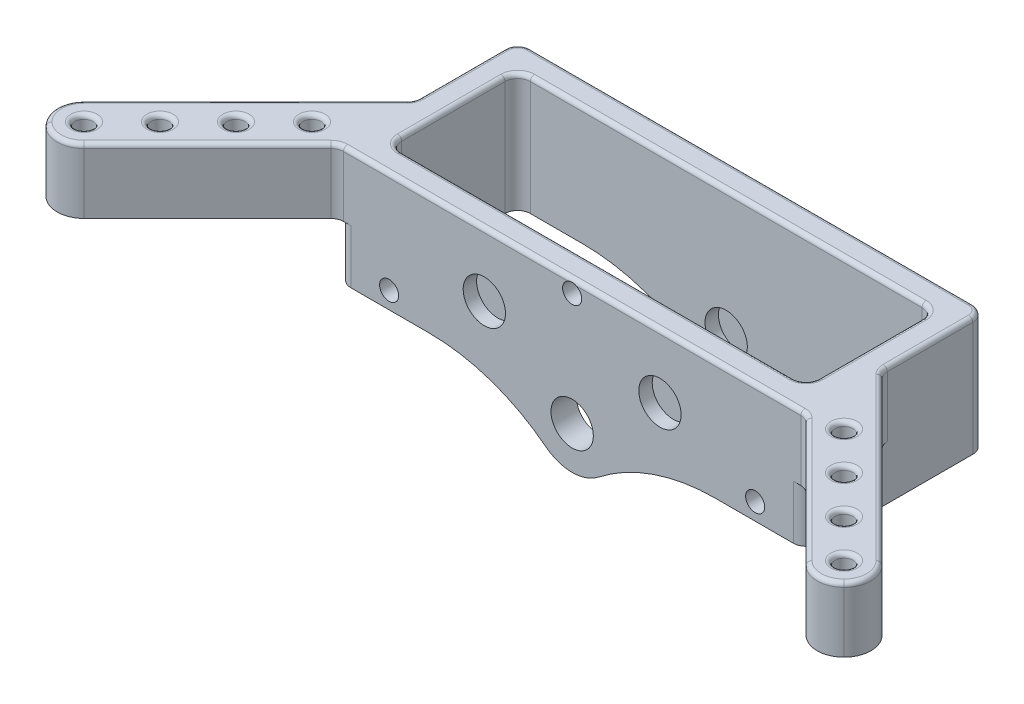
from build123d import *

# Parameters (mm, degrees)
SKETCH2_R           = 2.1
SKETCH2_W           = 98.55
SKETCH2_H           = 30.4
BOSS_EXTRUDE1_DEPTH = 28
CUT_EXTRUDE1_START  = -42.4
SKETCH3_R           = 2.25
CUT_EXTRUDE1_DEPTH  = 6
BOSS_EXTRUDE2_DEPTH = 6
BOSS_EXTRUDE3_START = -42.4
BOSS_EXTRUDE3_DEPTH = 6
CUT_EXTRUDE3_START  = -6
CUT_EXTRUDE3_DEPTH  = 3.175
CUT_EXTRUDE4_START  = -42.4
CUT_EXTRUDE4_DEPTH  = 6
FILLET2_R           = 6.35
CUT_EXTRUDE5_START  = -42.4
SKETCH4_7_R         = 5
CUT_EXTRUDE5_DEPTH  = 3.175
SKETCH2_4_R         = 2.1
CUT_EXTRUDE6_DEPTH  = 12.7
FILLET1_R           = 3
FILLET3_R           = 3
FILLET4_R           = 1


# Some blends are built 0.0001 mm under size
with BuildPart() as part:
    # Sketch2 → Boss-Extrude1 (new body)
    with BuildSketch(Plane(origin=(0, 0, 0), x_dir=(1, 0, 0), z_dir=(0, 1, 0))):
        Polygon((-89.802561211, -56.227561211), (-55.275, -21.7), (55.275, -21.7), (89.802561211, -56.227561211), (98.782817332, -47.24730509), (55.275, -3.739487758), (55.275, 20.7), (-55.275, 20.7), (-55.275, -3.739487758), (-98.782817332, -47.24730509), align=None)
        with Locations(Location((-89.802561211, -47.24730509, 0), (0, 0, 270))):
            Circle(SKETCH2_R, mode=Mode.SUBTRACT)
        with Locations(Location((-80.82230509, -38.267048969, 0), (0, 0, 270))):
            Circle(SKETCH2_R, mode=Mode.SUBTRACT)
        with Locations(Location((-71.842048969, -29.286792847, 0), (0, 0, 270))):
            Circle(SKETCH2_R, mode=Mode.SUBTRACT)
        with Locations(Location((-62.861792847, -20.306536726, 0), (0, 0, 270))):
            Circle(SKETCH2_R, mode=Mode.SUBTRACT)
        with Locations((0, -0.5)):
            Rectangle(SKETCH2_W, SKETCH2_H, mode=Mode.SUBTRACT)
        with Locations(Location((62.861792847, -20.306536726, 0), (0, 0, 270))):
            Circle(SKETCH2_R, mode=Mode.SUBTRACT)
        with Locations(Location((89.802561211, -47.24730509, 0), (0, 0, 270))):
            Circle(SKETCH2_R, mode=Mode.SUBTRACT)
        with Locations(Location((80.82230509, -38.267048969, 0), (0, 0, 270))):
            Circle(SKETCH2_R, mode=Mode.SUBTRACT)
        with Locations(Location((71.842048969, -29.286792847, 0), (0, 0, 270))):
            Circle(SKETCH2_R, mode=Mode.SUBTRACT)
    extrude(amount=BOSS_EXTRUDE1_DEPTH)

    # Sketch3 → Cut-Extrude1 (cut)
    with BuildSketch(Plane(origin=(0, 0, -20.7), x_dir=(-1, 0, 0), z_dir=(0, 0, -1)).offset(CUT_EXTRUDE1_START)):
        with Locations((-43.25, 4)):
            Circle(SKETCH3_R)
        with Locations((0, 25)):
            Circle(SKETCH3_R)
        with Locations((43.25, 4)):
            Circle(SKETCH3_R)
    extrude(amount=CUT_EXTRUDE1_DEPTH, mode=Mode.SUBTRACT)

    # Sketch4 → Boss-Extrude2 (add)
    with BuildSketch(Plane(origin=(0, 0, -20.7), x_dir=(-1, 0, 0), z_dir=(0, 0, -1))):
        with BuildLine():
            ThreePointArc((6.154225479, -9.531120391), (19.204123936, -2.44944429), (33.84824251, 0))
            Line((33.84824251, 0), (-33.848242566, 0))
            ThreePointArc((-33.848242566, 0), (-19.204124104, -2.449444233), (-6.154225714, -9.531120208))
            ThreePointArc((-6.154225714, -9.531120208), (-1.49e-07, -11.649146733), (6.154225479, -9.531120391))
        make_face()
    extrude(amount=-BOSS_EXTRUDE2_DEPTH)

    # Sketch4<3> → Boss-Extrude3 (add)
    with BuildSketch(Plane(origin=(0, 0, -20.7), x_dir=(-1, 0, 0), z_dir=(0, 0, -1)).offset(BOSS_EXTRUDE3_START)):
        with BuildLine():
            ThreePointArc((6.154225479, -9.531120391), (19.204123936, -2.44944429), (33.84824251, 0))
            Line((33.84824251, 0), (-33.848242566, 0))
            ThreePointArc((-33.848242566, 0), (-19.204124104, -2.449444233), (-6.154225714, -9.531120208))
            ThreePointArc((-6.154225714, -9.531120208), (-1.49e-07, -11.649146733), (6.154225479, -9.531120391))
        make_face()
    extrude(amount=BOSS_EXTRUDE3_DEPTH)

    # Sketch4<5> → Cut-Extrude3 (cut)
    with BuildSketch(Plane(origin=(0, 0, -20.7), x_dir=(-1, 0, 0), z_dir=(0, 0, -1)).offset(CUT_EXTRUDE3_START)):
        with BuildLine():
            ThreePointArc((5, -1.649146733), (4.929554458, -0.812789844), (4.720202861, 0))
            Line((4.720202861, 0), (-4.720202861, 0))
            ThreePointArc((-4.720202861, 0), (-0.836356889, -6.578701191), (5, -1.649146733))
        make_face()
        with BuildLine():
            Line((-4.720202861, 0), (4.720202861, 0))
            ThreePointArc((4.720202861, 0), (0, 3.350853267), (-4.720202861, 0))
        make_face()
    extrude(amount=CUT_EXTRUDE3_DEPTH, mode=Mode.SUBTRACT)

    # Sketch4<6> → Cut-Extrude4 (cut)
    with BuildSketch(Plane(origin=(0, 0, -20.7), x_dir=(-1, 0, 0), z_dir=(0, 0, -1)).offset(CUT_EXTRUDE4_START)):
        with BuildLine():
            ThreePointArc((5, -1.649146733), (4.929554458, -0.812789844), (4.720202861, 0))
            Line((4.720202861, 0), (-4.720202861, 0))
            ThreePointArc((-4.720202861, 0), (-0.836356889, -6.578701191), (5, -1.649146733))
        make_face()
        with BuildLine():
            Line((-4.720202861, 0), (4.720202861, 0))
            ThreePointArc((4.720202861, 0), (0, 3.350853267), (-4.720202861, 0))
        make_face()
    extrude(amount=CUT_EXTRUDE4_DEPTH, mode=Mode.SUBTRACT)

    # Fillet2
    fillet2_edges = [part.edges().sort_by_distance(p)[0] for p in [
        (98.782817332, 14, 47.24730509),
        (89.802561211, 14, 56.227561211),
        (-89.802561211, 14, 56.227561211),
        (-98.782817332, 14, 47.24730509),
    ]]
    fillet(fillet2_edges, radius=FILLET2_R - 0.0001)  # a hair under: the kernel refuses the full size

    # Sketch4<7> → Cut-Extrude5 (cut)
    with BuildSketch(Plane(origin=(0, 0, -20.7), x_dir=(-1, 0, 0), z_dir=(0, 0, -1)).offset(CUT_EXTRUDE5_START)):
        with Locations((-20.75, 13)):
            Circle(SKETCH4_7_R)
        with Locations((20.75, 13)):
            Circle(SKETCH4_7_R)
    extrude(amount=CUT_EXTRUDE5_DEPTH, mode=Mode.SUBTRACT)

    # Sketch2<4> → Cut-Extrude6 (cut)
    # profile 1 of 2: a face of its own
    with BuildSketch(Plane(origin=(0, 0, 0), x_dir=(1, 0, 0), z_dir=(0, 1, 0))):
        Polygon((-89.802561211, -56.227561211), (-55.275, -21.7), (-55.275, -3.739487758), (-98.782817332, -47.24730509), align=None)
        with Locations(Location((-89.802561211, -47.24730509, 0), (0, 0, 270))):
            Circle(SKETCH2_4_R, mode=Mode.SUBTRACT)
        with Locations(Location((-80.82230509, -38.267048969, 0), (0, 0, 270))):
            Circle(SKETCH2_4_R, mode=Mode.SUBTRACT)
        with Locations(Location((-71.842048969, -29.286792847, 0), (0, 0, 270))):
            Circle(SKETCH2_4_R, mode=Mode.SUBTRACT)
        with Locations(Location((-62.861792847, -20.306536726, 0), (0, 0, 270))):
            Circle(SKETCH2_4_R, mode=Mode.SUBTRACT)
    # profile 2 of 2: a face of its own
    with BuildSketch(Plane(origin=(0, 0, 0), x_dir=(1, 0, 0), z_dir=(0, 1, 0))):
        Polygon((55.275, -3.739487758), (55.275, -21.7), (89.802561211, -56.227561211), (98.782817332, -47.24730509), align=None)
        with Locations(Location((89.802561211, -47.24730509, 0), (0, 0, 270))):
            Circle(SKETCH2_4_R, mode=Mode.SUBTRACT)
        with Locations(Location((80.82230509, -38.267048969, 0), (0, 0, 270))):
            Circle(SKETCH2_4_R, mode=Mode.SUBTRACT)
        with Locations(Location((71.842048969, -29.286792847, 0), (0, 0, 270))):
            Circle(SKETCH2_4_R, mode=Mode.SUBTRACT)
        with Locations(Location((62.861792847, -20.306536726, 0), (0, 0, 270))):
            Circle(SKETCH2_4_R, mode=Mode.SUBTRACT)
    extrude(amount=CUT_EXTRUDE6_DEPTH, mode=Mode.SUBTRACT)

    # Fillet1
    fillet1_edges = [part.edges().sort_by_distance(p)[0] for p in [
        (-55.275, 6.35, 21.7),
        (55.275, 6.35, 21.7),
        (-49.275, 14, -14.7),
        (-49.275, 14, 15.7),
        (49.275, 14, 15.7),
        (49.275, 14, -14.7),
        (-55.275, 14, -20.7),
        (55.275, 14, -20.7),
    ]]
    fillet(fillet1_edges, radius=FILLET1_R)

    # Fillet3
    fillet3_edges = [part.edges().sort_by_distance(p)[0] for p in [
        (55.275, 20.35, 3.739487758),
        (55.275, 20.35, 21.7),
        (-55.275, 20.35, 21.7),
        (-55.275, 20.35, 3.739487758),
    ]]
    fillet(fillet3_edges, radius=FILLET3_R)

    # Fillet4
    # the kernel refuses this fillet: 1 mm, written as the material it takes off along each edge
    with BuildSketch(Plane(origin=(80.82230509, 28, 38.267048969), x_dir=(0, 0, 1), z_dir=(-1, 0, 0))) as fillet4_piece_1:
        with BuildLine():
            CenterArc((2.1 + FILLET4_R, -FILLET4_R), FILLET4_R, 90, 90)
            Line((2.1 + FILLET4_R, 0), (2.1, 0))
            Line((2.1, 0), (2.1, -FILLET4_R))
        make_face()
    revolve(axis=Axis((80.82230509, 28, 38.267048969), (0, 1, 0)), mode=Mode.SUBTRACT)
    with BuildSketch(Plane(origin=(62.861792847, 28, 20.306536726), x_dir=(0, 0, 1), z_dir=(-1, 0, 0))) as fillet4_piece_2:
        with BuildLine():
            CenterArc((2.1 + FILLET4_R, -FILLET4_R), FILLET4_R, 90, 90)
            Line((2.1 + FILLET4_R, 0), (2.1, 0))
            Line((2.1, 0), (2.1, -FILLET4_R))
        make_face()
    revolve(axis=Axis((62.861792847, 28, 20.306536726), (0, 1, 0)), mode=Mode.SUBTRACT)
    with BuildSketch(Plane(origin=(89.802561211, 28, 47.24730509), x_dir=(0, 0, 1), z_dir=(-1, 0, 0))) as fillet4_piece_3:
        with BuildLine():
            CenterArc((2.1 + FILLET4_R, -FILLET4_R), FILLET4_R, 90, 90)
            Line((2.1 + FILLET4_R, 0), (2.1, 0))
            Line((2.1, 0), (2.1, -FILLET4_R))
        make_face()
    revolve(axis=Axis((89.802561211, 28, 47.24730509), (0, 1, 0)), mode=Mode.SUBTRACT)
    with BuildSketch(Plane(origin=(94.292759982, 28, 42.75724774), x_dir=(0, -1, 0), z_dir=(-0.7071067811865493, 0, -0.7071067811865457)), Plane(origin=(-56.153679656, 28, 4.618167414), x_dir=(0, -1, 0), z_dir=(-0.707106781186541, 0, 0.707106781186554))) as fillet4_piece_4:
        with BuildLine():
            CenterArc((FILLET4_R, FILLET4_R), FILLET4_R, 180, 90)
            Line((0, FILLET4_R), (0, 0))
            Line((0, 0), (FILLET4_R, 0))
        make_face()
    extrude(amount=53.936804653, mode=Mode.SUBTRACT)
    with BuildSketch(Plane(origin=(71.842048969, 28, 29.286792847), x_dir=(0, 0, 1), z_dir=(-1, 0, 0))) as fillet4_piece_5:
        with BuildLine():
            CenterArc((2.1 + FILLET4_R, -FILLET4_R), FILLET4_R, 90, 90)
            Line((2.1 + FILLET4_R, 0), (2.1, 0))
            Line((2.1, 0), (2.1, -FILLET4_R))
        make_face()
    revolve(axis=Axis((71.842048969, 28, 29.286792847), (0, 1, 0)), mode=Mode.SUBTRACT)
    with BuildSketch(Plane(origin=(-89.802702632, 28, 47.24730509), x_dir=(-0.7071067811865537, 0, -0.7071067811865414), z_dir=(0.7071067811865414, 0, -0.7071067811865537))) as fillet4_piece_6:
        with BuildLine():
            CenterArc((6.3499 - FILLET4_R, -FILLET4_R), FILLET4_R, 0, 90)
            Line((6.3499 - FILLET4_R, 0), (6.3499, 0))
            Line((6.3499, 0), (6.3499, -FILLET4_R))
        make_face()
    revolve(axis=Axis((-89.802702632, 28, 47.24730509), (0, 1, 0)), revolution_arc=90, mode=Mode.SUBTRACT)
    with BuildSketch(Plane(origin=(-89.802561211, 28, 47.247446511), x_dir=(-0.7071067811865425, 0, 0.7071067811865526), z_dir=(-0.7071067811865526, 0, -0.7071067811865425))) as fillet4_piece_7:
        with BuildLine():
            CenterArc((6.3499 - FILLET4_R, -FILLET4_R), FILLET4_R, 0, 90)
            Line((6.3499 - FILLET4_R, 0), (6.3499, 0))
            Line((6.3499, 0), (6.3499, -FILLET4_R))
        make_face()
    revolve(axis=Axis((-89.802561211, 28, 47.247446511), (0, 1, 0)), revolution_arc=90, mode=Mode.SUBTRACT)
    with BuildSketch(Plane(origin=(89.802561211, 28, 47.247446511), x_dir=(-0.7071067811865469, 0, 0.707106781186548), z_dir=(-0.707106781186548, 0, -0.7071067811865469))) as fillet4_piece_8:
        with BuildLine():
            CenterArc((6.3499 - FILLET4_R, -FILLET4_R), FILLET4_R, 0, 90)
            Line((6.3499 - FILLET4_R, 0), (6.3499, 0))
            Line((6.3499, 0), (6.3499, -FILLET4_R))
        make_face()
    revolve(axis=Axis((89.802561211, 28, 47.247446511), (0, 1, 0)), revolution_arc=90, mode=Mode.SUBTRACT)
    with BuildSketch(Plane(origin=(89.802702632, 28, 47.24730509), x_dir=(0.7071067811865542, 0, 0.7071067811865408), z_dir=(-0.7071067811865408, 0, 0.7071067811865542))) as fillet4_piece_9:
        with BuildLine():
            CenterArc((6.3499 - FILLET4_R, -FILLET4_R), FILLET4_R, 0, 90)
            Line((6.3499 - FILLET4_R, 0), (6.3499, 0))
            Line((6.3499, 0), (6.3499, -FILLET4_R))
        make_face()
    revolve(axis=Axis((89.802702632, 28, 47.24730509), (0, 1, 0)), revolution_arc=90, mode=Mode.SUBTRACT)
    with BuildSketch(Plane(origin=(-55.275, 28, -17.7), x_dir=(0, -1, 0), z_dir=(0, 0, 1)), Plane(origin=(55.275, 28, 2.496847071), x_dir=(0, -1, 0), z_dir=(0, 0, -1))) as fillet4_piece_10:
        with BuildLine():
            CenterArc((FILLET4_R, FILLET4_R), FILLET4_R, 180, 90)
            Line((0, FILLET4_R), (0, 0))
            Line((0, 0), (FILLET4_R, 0))
        make_face()
    extrude(amount=20.196847071, mode=Mode.SUBTRACT)
    with BuildSketch(Plane(origin=(46.275, 28, 15.7), x_dir=(0, -1, 0), z_dir=(-1, 0, 0)), Plane(origin=(-46.275, 28, -14.7), x_dir=(0, -1, 0), z_dir=(1, 0, 0))) as fillet4_piece_11:
        with BuildLine():
            CenterArc((FILLET4_R, FILLET4_R), FILLET4_R, 180, 90)
            Line((0, FILLET4_R), (0, 0))
            Line((0, 0), (FILLET4_R, 0))
        make_face()
    extrude(amount=92.55, mode=Mode.SUBTRACT)
    with BuildSketch(Plane(origin=(49.275, 28, -11.7), x_dir=(0, -1, 0), z_dir=(0, 0, 1)), Plane(origin=(-49.275, 28, 12.7), x_dir=(0, -1, 0), z_dir=(0, 0, -1))) as fillet4_piece_12:
        with BuildLine():
            CenterArc((FILLET4_R, FILLET4_R), FILLET4_R, 180, 90)
            Line((0, FILLET4_R), (0, 0))
            Line((0, 0), (FILLET4_R, 0))
        make_face()
    extrude(amount=24.4, mode=Mode.SUBTRACT)
    with BuildSketch(Plane(origin=(52.275, 28, -20.7), x_dir=(0, -1, 0), z_dir=(-1, 0, 0))) as fillet4_piece_13:
        with BuildLine():
            CenterArc((FILLET4_R, FILLET4_R), FILLET4_R, 180, 90)
            Line((0, FILLET4_R), (0, 0))
            Line((0, 0), (FILLET4_R, 0))
        make_face()
    extrude(amount=104.55, mode=Mode.SUBTRACT)
    with BuildSketch(Plane(origin=(-52.275, 28, -17.7), x_dir=(-1, 0, 0), z_dir=(0, 0, 1))) as fillet4_piece_14:
        with BuildLine():
            CenterArc((3 - FILLET4_R, FILLET4_R), FILLET4_R, 270, 90)
            Line((3 - FILLET4_R, 0), (3, 0))
            Line((3, 0), (3, FILLET4_R))
        make_face()
    revolve(axis=Axis((-52.275, 28, -17.7), (0, -1, 0)), revolution_arc=90, mode=Mode.SUBTRACT)
    with BuildSketch(Plane(origin=(52.275, 28, -17.7), x_dir=(1, 0, 0), z_dir=(0, 0, 1))) as fillet4_piece_15:
        with BuildLine():
            CenterArc((3 - FILLET4_R, -FILLET4_R), FILLET4_R, 0, 90)
            Line((3 - FILLET4_R, 0), (3, 0))
            Line((3, 0), (3, -FILLET4_R))
        make_face()
    revolve(axis=Axis((52.275, 28, -17.7), (0, 1, 0)), revolution_arc=90, mode=Mode.SUBTRACT)
    with BuildSketch(Plane(origin=(46.275, 28, 12.7), x_dir=(1, 0, 0), z_dir=(0, 0, -1))) as fillet4_piece_16:
        with BuildLine():
            CenterArc((3 + FILLET4_R, FILLET4_R), FILLET4_R, 180, 90)
            Line((3 + FILLET4_R, 0), (3, 0))
            Line((3, 0), (3, FILLET4_R))
        make_face()
    revolve(axis=Axis((46.275, 28, 12.7), (0, -1, 0)), revolution_arc=90, mode=Mode.SUBTRACT)
    with BuildSketch(Plane(origin=(-46.275, 28, 12.7), x_dir=(-1, 0, 0), z_dir=(0, 0, -1))) as fillet4_piece_17:
        with BuildLine():
            CenterArc((3 + FILLET4_R, -FILLET4_R), FILLET4_R, 90, 90)
            Line((3 + FILLET4_R, 0), (3, 0))
            Line((3, 0), (3, -FILLET4_R))
        make_face()
    revolve(axis=Axis((-46.275, 28, 12.7), (0, 1, 0)), revolution_arc=90, mode=Mode.SUBTRACT)
    with BuildSketch(Plane(origin=(46.275, 28, -11.7), x_dir=(1, 0, 0), z_dir=(0, 0, 1))) as fillet4_piece_18:
        with BuildLine():
            CenterArc((3 + FILLET4_R, -FILLET4_R), FILLET4_R, 90, 90)
            Line((3 + FILLET4_R, 0), (3, 0))
            Line((3, 0), (3, -FILLET4_R))
        make_face()
    revolve(axis=Axis((46.275, 28, -11.7), (0, 1, 0)), revolution_arc=90, mode=Mode.SUBTRACT)
    with BuildSketch(Plane(origin=(-46.275, 28, -11.7), x_dir=(0, 0, -1), z_dir=(1, 0, 0))) as fillet4_piece_19:
        with BuildLine():
            CenterArc((3 + FILLET4_R, -FILLET4_R), FILLET4_R, 90, 90)
            Line((3 + FILLET4_R, 0), (3, 0))
            Line((3, 0), (3, -FILLET4_R))
        make_face()
    revolve(axis=Axis((-46.275, 28, -11.7), (0, 1, 0)), revolution_arc=90, mode=Mode.SUBTRACT)
    with BuildSketch(Plane(origin=(-54.032359313, 28, 21.7), x_dir=(0, -1, 0), z_dir=(1, 0, 0))) as fillet4_piece_20:
        with BuildLine():
            CenterArc((FILLET4_R, FILLET4_R), FILLET4_R, 180, 90)
            Line((0, FILLET4_R), (0, 0))
            Line((0, 0), (FILLET4_R, 0))
        make_face()
    extrude(amount=108.064718626, mode=Mode.SUBTRACT)
    with BuildSketch(Plane(origin=(-85.312503861, 28, 51.737503861), x_dir=(0, -1, 0), z_dir=(0.7071067811865411, 0, -0.707106781186554)), Plane(origin=(56.153679656, 28, 22.578679656), x_dir=(0, -1, 0), z_dir=(0.7071067811865481, 0, 0.707106781186547))) as fillet4_piece_21:
        with BuildLine():
            CenterArc((FILLET4_R, FILLET4_R), FILLET4_R, 180, 90)
            Line((0, FILLET4_R), (0, 0))
            Line((0, 0), (FILLET4_R, 0))
        make_face()
    extrude(amount=41.236804653, mode=Mode.SUBTRACT)
    with BuildSketch(Plane(origin=(-58.275, 28, 2.496847071), x_dir=(1, 0, 0), z_dir=(0, 0, -1))) as fillet4_piece_22:
        with BuildLine():
            CenterArc((3 + FILLET4_R, FILLET4_R), FILLET4_R, 180, 90)
            Line((3 + FILLET4_R, 0), (3, 0))
            Line((3, 0), (3, FILLET4_R))
        make_face()
    revolve(axis=Axis((-58.275, 28, 2.496847071), (0, -1, 0)), revolution_arc=45, mode=Mode.SUBTRACT)
    with BuildSketch(Plane(origin=(-54.032359313, 28, 24.7), x_dir=(-0.7071067811865552, 0, -0.7071067811865398), z_dir=(-0.7071067811865398, 0, 0.7071067811865552))) as fillet4_piece_23:
        with BuildLine():
            CenterArc((3 + FILLET4_R, FILLET4_R), FILLET4_R, 180, 90)
            Line((3 + FILLET4_R, 0), (3, 0))
            Line((3, 0), (3, FILLET4_R))
        make_face()
    revolve(axis=Axis((-54.032359313, 28, 24.7), (0, -1, 0)), revolution_arc=45, mode=Mode.SUBTRACT)
    with BuildSketch(Plane(origin=(54.032359313, 28, 24.7), x_dir=(0, 0, -1), z_dir=(-1, 0, 0))) as fillet4_piece_24:
        with BuildLine():
            CenterArc((3 + FILLET4_R, FILLET4_R), FILLET4_R, 180, 90)
            Line((3 + FILLET4_R, 0), (3, 0))
            Line((3, 0), (3, FILLET4_R))
        make_face()
    revolve(axis=Axis((54.032359313, 28, 24.7), (0, -1, 0)), revolution_arc=45, mode=Mode.SUBTRACT)
    with BuildSketch(Plane(origin=(58.275, 28, 2.496847071), x_dir=(-1, 0, 0), z_dir=(0, 0, -1))) as fillet4_piece_25:
        with BuildLine():
            CenterArc((3 + FILLET4_R, -FILLET4_R), FILLET4_R, 90, 90)
            Line((3 + FILLET4_R, 0), (3, 0))
            Line((3, 0), (3, -FILLET4_R))
        make_face()
    revolve(axis=Axis((58.275, 28, 2.496847071), (0, 1, 0)), revolution_arc=45, mode=Mode.SUBTRACT)
    with BuildSketch(Plane(origin=(-80.82230509, 28, 38.267048969), x_dir=(0, 0, 1), z_dir=(-1, 0, 0))) as fillet4_piece_26:
        with BuildLine():
            CenterArc((2.1 + FILLET4_R, -FILLET4_R), FILLET4_R, 90, 90)
            Line((2.1 + FILLET4_R, 0), (2.1, 0))
            Line((2.1, 0), (2.1, -FILLET4_R))
        make_face()
    revolve(axis=Axis((-80.82230509, 28, 38.267048969), (0, 1, 0)), mode=Mode.SUBTRACT)
    with BuildSketch(Plane(origin=(-62.861792847, 28, 20.306536726), x_dir=(0, 0, 1), z_dir=(-1, 0, 0))) as fillet4_piece_27:
        with BuildLine():
            CenterArc((2.1 + FILLET4_R, -FILLET4_R), FILLET4_R, 90, 90)
            Line((2.1 + FILLET4_R, 0), (2.1, 0))
            Line((2.1, 0), (2.1, -FILLET4_R))
        make_face()
    revolve(axis=Axis((-62.861792847, 28, 20.306536726), (0, 1, 0)), mode=Mode.SUBTRACT)
    with BuildSketch(Plane(origin=(-71.842048969, 28, 29.286792847), x_dir=(0, 0, 1), z_dir=(-1, 0, 0))) as fillet4_piece_28:
        with BuildLine():
            CenterArc((2.1 + FILLET4_R, -FILLET4_R), FILLET4_R, 90, 90)
            Line((2.1 + FILLET4_R, 0), (2.1, 0))
            Line((2.1, 0), (2.1, -FILLET4_R))
        make_face()
    revolve(axis=Axis((-71.842048969, 28, 29.286792847), (0, 1, 0)), mode=Mode.SUBTRACT)
    with BuildSketch(Plane(origin=(-89.802561211, 28, 47.24730509), x_dir=(0, 0, 1), z_dir=(-1, 0, 0))) as fillet4_piece_29:
        with BuildLine():
            CenterArc((2.1 + FILLET4_R, -FILLET4_R), FILLET4_R, 90, 90)
            Line((2.1 + FILLET4_R, 0), (2.1, 0))
            Line((2.1, 0), (2.1, -FILLET4_R))
        make_face()
    revolve(axis=Axis((-89.802561211, 28, 47.24730509), (0, 1, 0)), mode=Mode.SUBTRACT)
    with BuildSketch(Plane(origin=(94.292618561, 28, 51.737503861), x_dir=(0, -1, 0), z_dir=(0.7071067811865406, 0, -0.7071067811865546)), Plane(origin=(-94.292759982, 28, 51.737362439), x_dir=(0, -1, 0), z_dir=(0.7071067811865535, 0, 0.7071067811865417))) as fillet4_piece_30:
        with BuildLine():
            CenterArc((FILLET4_R, FILLET4_R), FILLET4_R, 180, 90)
            Line((0, FILLET4_R), (0, 0))
            Line((0, 0), (FILLET4_R, 0))
        make_face()
    extrude(amount=0.0002, mode=Mode.SUBTRACT)


solid = part.part
